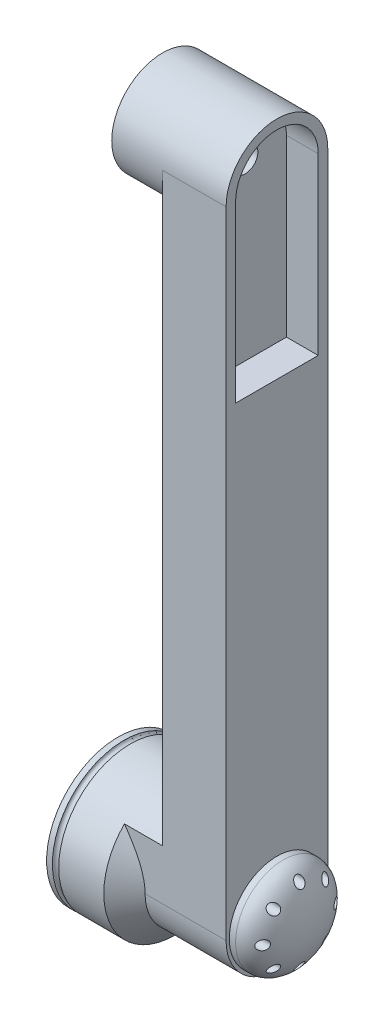
from build123d import *

# Parameters (mm, degrees)
SKETCH2_R           = 22.5
BOSS_EXTRUDE1_DEPTH = 30
BOSS_EXTRUDE2_DEPTH = 20
CHAMFER1_START      = 18
CHAMFER1_OUTLINE_R  = 22.5
CHAMFER1_DEPTH      = 12
CHAMFER1_3_DEPTH    = 12
SKETCH8_R           = 3
CUT_EXTRUDE4_DEPTH  = 50
CUT_EXTRUDE5_DEPTH  = 10
SKETCH9_R           = 15
BOSS_EXTRUDE3_DEPTH = 2
DOME1_FACE_RADIUS   = 15
DOME1_HEIGHT        = 8
SKETCH13_R          = 1.5
CUT_EXTRUDE6_DEPTH  = 223.850286
SKETCH14_R          = 1
BOSS_EXTRUDE5_START = 16
SKETCH15_R          = 16
BOSS_EXTRUDE5_DEPTH = 16
SKETCH16_R          = 14
CUT_EXTRUDE7_DEPTH  = 20
SKETCH17_R          = 4
CUT_EXTRUDE8_DEPTH  = 2
CUT_EXTRUDE9_START  = -2
SKETCH18_R          = 4
CUT_EXTRUDE9_DEPTH  = 2
SKETCH19_R          = 3
CUT_EXTRUDE10_DEPTH = 221.132347


with BuildPart() as part:
    # Sketch2 → Boss-Extrude1 (new body)
    with BuildSketch(Plane(origin=(0, 0, 0), x_dir=(0, 0, -1), z_dir=(1, 0, 0))):
        Circle(SKETCH2_R)
    extrude(amount=BOSS_EXTRUDE1_DEPTH)

    # Sketch3 → Boss-Extrude2 (add)
    with BuildSketch(Plane(origin=(30, 0, 0), x_dir=(0, 0, -1), z_dir=(1, 0, 0))):
        with BuildLine():
            Line((-16, 0), (-16, 200))
            ThreePointArc((-16, 200), (0, 216), (16, 200))
            Line((16, 200), (16, 0))
            ThreePointArc((16, 0), (0, -16), (-16, 0))
        make_face()
    extrude(amount=BOSS_EXTRUDE2_DEPTH)

    # Chamfer1: read off the stored shape, not the designer's step
    # Chamfer1 outline → Chamfer1 (cut)
    with BuildSketch(Plane.YZ.offset(CHAMFER1_START)):
        Circle(CHAMFER1_OUTLINE_R)
    extrude(amount=CHAMFER1_DEPTH, mode=Mode.SUBTRACT)

    # Chamfer1 2 outline → Chamfer1 2 (revolve)
    with BuildSketch(Plane.YX):
        Polygon((0, 18), (22.5, 18), (15.999995, 24.500005), (0, 24.500005), align=None)
    revolve(axis=Axis((0, 0, 0), (1, 0, 0)))

    # Chamfer1 3 outline → Chamfer1 3 (add)
    with BuildSketch(Plane.YZ.offset(CHAMFER1_START)):
        with BuildLine():
            ThreePointArc((15.819292, -16), (22.5, 0), (15.819292, 16))
            Line((15.819292, 16), (0, 16))
            ThreePointArc((0, 16), (-16, 0), (0, -16))
            Line((0, -16), (15.819292, -16))
        make_face()
    extrude(amount=CHAMFER1_3_DEPTH)

    # Sketch8 → Cut-Extrude4 (cut)
    with BuildSketch(Plane.ZY):
        Circle(SKETCH8_R)
    extrude(amount=-CUT_EXTRUDE4_DEPTH, mode=Mode.SUBTRACT)

    # Sketch12 → Cut-Extrude5 (cut)
    with BuildSketch(Plane(origin=(50, 0, 0), x_dir=(0, 0, -1), z_dir=(1, 0, 0))):
        with BuildLine():
            Line((-13, 200), (-13, 145))
            Line((-13, 145), (13, 145))
            Line((13, 145), (13, 200))
            ThreePointArc((13, 200), (0, 213), (-13, 200))
        make_face()
    extrude(amount=-CUT_EXTRUDE5_DEPTH, mode=Mode.SUBTRACT)

    # Sketch9 → Boss-Extrude3 (add)
    with BuildSketch(Plane(origin=(50, 0, 0), x_dir=(0, 0, -1), z_dir=(1, 0, 0))):
        Circle(SKETCH9_R)
    extrude(amount=BOSS_EXTRUDE3_DEPTH)

    # Dome1: an elliptical dome of height H over a round flat face of radius A is half a spheroid: the quarter ellipse of half axes A and H revolved about the face's axis
    with BuildSketch(Plane((52, 0, 0), x_dir=(0, 0, 1), z_dir=(0, 1, 0)), mode=Mode.PRIVATE) as dome1_quarter:
        Ellipse(DOME1_FACE_RADIUS, DOME1_HEIGHT)
        Rectangle(DOME1_FACE_RADIUS, DOME1_HEIGHT, align=(Align.MIN, Align.MIN), mode=Mode.INTERSECT)
    revolve(dome1_quarter.sketch, axis=Axis((52, 0, 0), (1, 0, 0)))

    # Sketch13 → Cut-Extrude6 (cut, through all)
    with BuildSketch(Plane(origin=(50, 0, 0), x_dir=(0, 0, -1), z_dir=(1, 0, 0))):
        with Locations(Location((0, 11.481393, 0), (0, 0, 180))):
            Circle(SKETCH13_R)
        with Locations(Location((8.118571, 8.118571, 0), (0, 0, 180))):
            Circle(SKETCH13_R)
        with Locations((11.481393, 0)):
            Circle(SKETCH13_R)
        with Locations(Location((8.118571, -8.118571, 0), (0, 0, 180))):
            Circle(SKETCH13_R)
        with Locations(Location((0, -11.481393, 0), (0, 0, 180))):
            Circle(SKETCH13_R)
        with Locations(Location((-8.118571, -8.118571, 0), (0, 0, 180))):
            Circle(SKETCH13_R)
        with Locations(Location((-11.481393, 0, 0), (0, 0, 180))):
            Circle(SKETCH13_R)
        with Locations(Location((-8.118571, 8.118571, 0), (0, 0, 180))):
            Circle(SKETCH13_R)
    extrude(amount=CUT_EXTRUDE6_DEPTH, mode=Mode.SUBTRACT)

    # Sketch14 → Cut-Revolve1 (revolve, cut)
    with BuildSketch(Plane.XY, mode=Mode.PRIVATE) as cut_revolve1_sk:
        with Locations((2.818776, 22.5)):
            Circle(SKETCH14_R)
    revolve(cut_revolve1_sk.sketch.rotate(Axis((0, 0, 0), (-1, 0, 0)), 90), axis=Axis((0, 0, 0), (-1, 0, 0)), mode=Mode.SUBTRACT)

    # Sketch15 → Boss-Extrude5 (add)
    with BuildSketch(Plane.ZY.offset(-30).offset(BOSS_EXTRUDE5_START)):
        with Locations((0, 200)):
            Circle(SKETCH15_R)
    extrude(amount=-BOSS_EXTRUDE5_DEPTH)

    # Sketch16 → Cut-Extrude7 (cut)
    with BuildSketch(Plane.ZY.offset(-14)):
        with Locations((0, 200)):
            Circle(SKETCH16_R)
    extrude(amount=-CUT_EXTRUDE7_DEPTH, mode=Mode.SUBTRACT)

    # Sketch17 → Cut-Extrude8 (cut)
    with BuildSketch(Plane.ZY.offset(-34)):
        with Locations((0, 200)):
            Circle(SKETCH17_R)
    extrude(amount=-CUT_EXTRUDE8_DEPTH, mode=Mode.SUBTRACT)

    # Sketch18 → Cut-Extrude9 (cut)
    with BuildSketch(Plane(origin=(40, 0, 0), x_dir=(0, 0, -1), z_dir=(1, 0, 0)).offset(CUT_EXTRUDE9_START)):
        with Locations(Location((0, 200, 0), (0, 0, 180))):
            Circle(SKETCH18_R)
    extrude(amount=CUT_EXTRUDE9_DEPTH, mode=Mode.SUBTRACT)

    # Sketch19 → Cut-Extrude10 (cut, through all)
    with BuildSketch(Plane.ZY.offset(-36)):
        with Locations((0, 200)):
            Circle(SKETCH19_R)
    extrude(amount=-CUT_EXTRUDE10_DEPTH, mode=Mode.SUBTRACT)


solid = part.part
